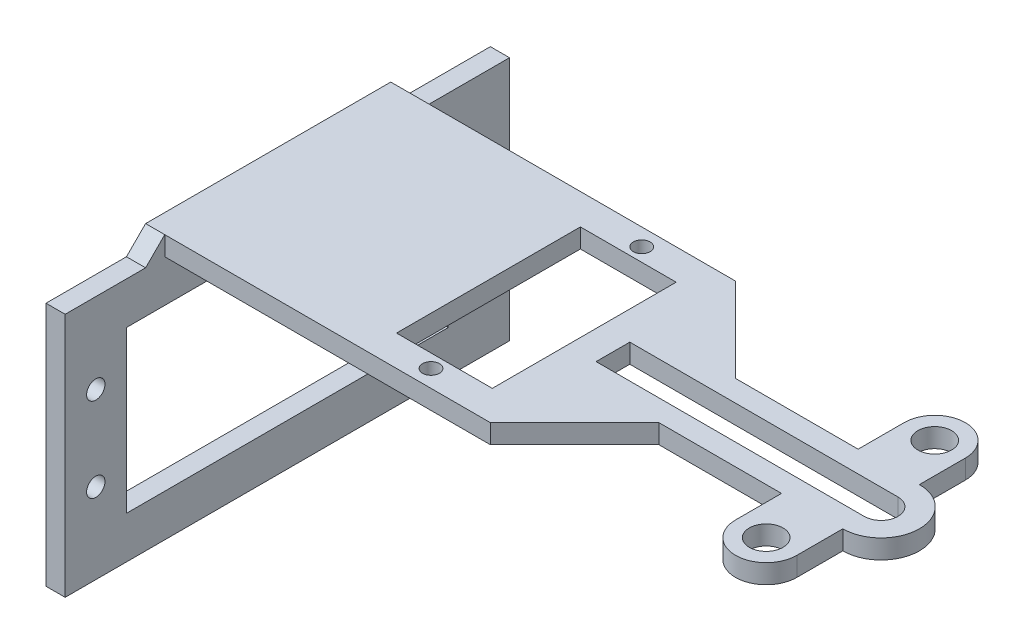
from build123d import *

# Parameters (mm, degrees)
SKETCH1_W           = 20
SKETCH1_H           = 32
SKETCH1_R           = 1.1
SKETCH1_W_2         = 12.5
SKETCH1_H_2         = 24
BOSS_EXTRUDE1_DEPTH = 2.5
BOSS_EXTRUDE2_DEPTH = 2.5
CHAMFER1_SIZE       = 11
SKETCH3_R           = 2.2
BOSS_EXTRUDE3_DEPTH = 2.5
SKETCH4_W           = 25
SKETCH4_H           = 32
BOSS_EXTRUDE4_DEPTH = 2.5
SKETCH5_W           = 58
SKETCH5_H           = 32
SKETCH5_R           = 1.2
SKETCH5_W_2         = 42
SKETCH5_H_2         = 21
BOSS_EXTRUDE5_DEPTH = 2.5
CHAMFER2_SIZE       = 2.5


with BuildPart() as part:
    # Sketch1 → Boss-Extrude1 (new body)
    with BuildSketch(Plane(origin=(0, 0, 0), x_dir=(1, 0, 0), z_dir=(0, 1, 0))):
        Rectangle(SKETCH1_W, SKETCH1_H)
        with Locations(Location((0, -13.75, 0), (0, 0, 270))):
            Circle(SKETCH1_R, mode=Mode.SUBTRACT)
        with Locations(Location((0, 13.75, 0), (0, 0, 270))):
            Circle(SKETCH1_R, mode=Mode.SUBTRACT)
        Rectangle(SKETCH1_W_2, SKETCH1_H_2, mode=Mode.SUBTRACT)
    extrude(amount=BOSS_EXTRUDE1_DEPTH)

    # Sketch2 → Boss-Extrude2 (add)
    with BuildSketch(Plane(origin=(0, 2.5, 0), x_dir=(1, 0, 0), z_dir=(0, 1, 0))):
        with BuildLine():
            Line((10, 5), (45, 5))
            ThreePointArc((45, 5), (50, 0), (45, -5))
            Line((45, -5), (10, -5))
            ThreePointArc((10, -5), (7.942810861, -4.557189139), (6.25, -3.307189139))
            Line((6.25, -3.307189139), (6.25, 3.307189139))
            ThreePointArc((6.25, 3.307189139), (7.942810861, 4.557189139), (10, 5))
        make_face()
        with BuildLine():
            Line((10, 2.2), (45, 2.2))
            ThreePointArc((45, 2.2), (47.2, 0), (45, -2.2))
            Line((45, -2.2), (10, -2.2))
            ThreePointArc((10, -2.2), (7.8, 0), (10, 2.2))
        make_face(mode=Mode.SUBTRACT)
    extrude(amount=-BOSS_EXTRUDE2_DEPTH)

    # Chamfer1
    chamfer1_edges = [part.edges().sort_by_distance(p)[0] for p in [
        (10, 1.25, 5),
        (10, 1.25, -5),
    ]]
    chamfer(chamfer1_edges, length=CHAMFER1_SIZE - 0.0001)  # a hair under: the kernel refuses the full size

    # Sketch3 → Boss-Extrude3 (add)
    # profile 1 of 2: a face of its own
    with BuildSketch(Plane(origin=(0, 2.5, 0), x_dir=(1, 0, 0), z_dir=(0, 1, 0))):
        with BuildLine():
            Line((45, -5), (45, -11))
            ThreePointArc((45, -11), (41, -15), (37, -11))
            Line((37, -11), (37, -5))
            Line((37, -5), (45, -5))
        make_face()
        with Locations(Location((41, -11, 0), (0, 0, 270))):
            Circle(SKETCH3_R, mode=Mode.SUBTRACT)
    # profile 2 of 2: a face of its own
    with BuildSketch(Plane(origin=(0, 2.5, 0), x_dir=(1, 0, 0), z_dir=(0, 1, 0))):
        with BuildLine():
            Line((45, 5), (45, 11))
            ThreePointArc((45, 11), (41, 15), (37, 11))
            Line((37, 11), (37, 5))
            Line((37, 5), (45, 5))
        make_face()
        with Locations(Location((41, 11, 0), (0, 0, 90))):
            Circle(SKETCH3_R, mode=Mode.SUBTRACT)
    extrude(amount=-BOSS_EXTRUDE3_DEPTH)

    # Sketch4 → Boss-Extrude4 (add)
    with BuildSketch(Plane(origin=(0, 2.5, 0), x_dir=(1, 0, 0), z_dir=(0, 1, 0))):
        with Locations((-22.5, 0)):
            Rectangle(SKETCH4_W, SKETCH4_H)
    extrude(amount=-BOSS_EXTRUDE4_DEPTH)

    # Sketch5 → Boss-Extrude5 (add)
    with BuildSketch(Plane.ZY.offset(35)):
        with Locations((0, -16)):
            Rectangle(SKETCH5_W, SKETCH5_H)
        with Locations((25, -10.5)):
            Circle(SKETCH5_R, mode=Mode.SUBTRACT)
        with Locations((25, -21.5)):
            Circle(SKETCH5_R, mode=Mode.SUBTRACT)
        with Locations((-25, -10.5)):
            Circle(SKETCH5_R, mode=Mode.SUBTRACT)
        with Locations((-25, -21.5)):
            Circle(SKETCH5_R, mode=Mode.SUBTRACT)
        with Locations((0, -16)):
            Rectangle(SKETCH5_W_2, SKETCH5_H_2, mode=Mode.SUBTRACT)
    extrude(amount=-BOSS_EXTRUDE5_DEPTH)

    # Chamfer2
    chamfer2_edges = [part.edges().sort_by_distance(p)[0] for p in [
        (-33.75, 0, -16),
        (-33.75, 0, 16),
    ]]
    chamfer(chamfer2_edges, length=CHAMFER2_SIZE - 0.0001)  # a hair under: the kernel refuses the full size


solid = part.part
